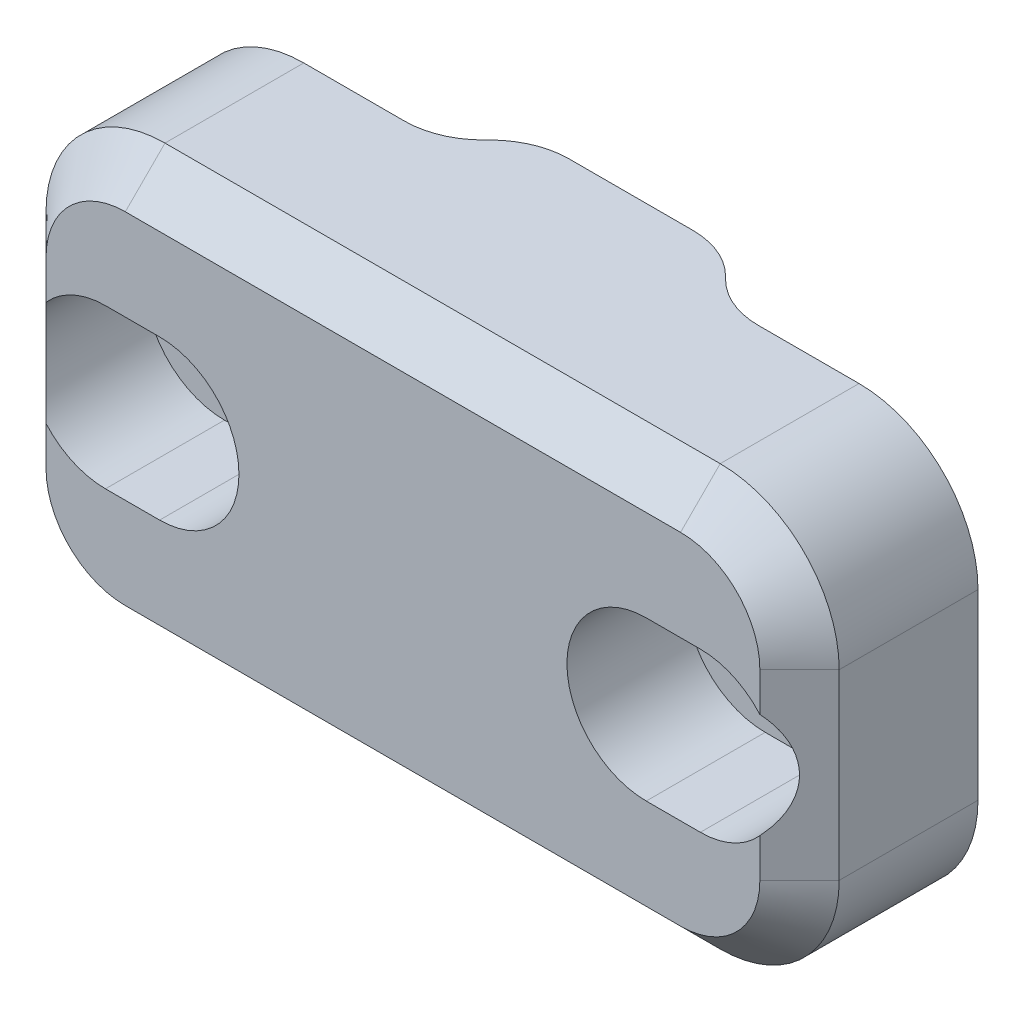
from build123d import *

# Parameters (mm, degrees)
SKETCH1_W           = 20
SKETCH1_H           = 12.6
BOSS_EXTRUDE1_DEPTH = 5
CUT_EXTRUDE1_REACH  = 19.616
SKETCH2_W           = 20
SKETCH2_H           = 0.5
CUT_EXTRUDE2_REACH  = 89.84
SKETCH3_W           = 20
SKETCH3_H           = 2
BOSS_EXTRUDE2_DEPTH = 10.6
CUT_EXTRUDE4_DEPTH  = 88.839697745
FILLET1_R           = 3
CUT_EXTRUDE5_DEPTH  = 3
CHAMFER2_SIZE       = 1
FILLET2_R           = 2


with BuildPart() as part:
    # Sketch1 → Boss-Extrude1 (new body)
    with BuildSketch(Plane.XY):
        with Locations((-1.25, 80.7)):
            Rectangle(SKETCH1_W, SKETCH1_H)
    extrude(amount=BOSS_EXTRUDE1_DEPTH)

    # Sketch2 → Cut-Extrude1 (cut, up to next)
    with BuildSketch(Plane(origin=(0, 87, 0), x_dir=(1, 0, 0), z_dir=(0, 1, 0)), mode=Mode.PRIVATE) as cut_extrude1_sk1:
        with Locations((-1.25, -0.25)):
            Rectangle(SKETCH2_W, SKETCH2_H)
    cut_extrude1_tool1 = extrude(cut_extrude1_sk1.sketch, amount=-CUT_EXTRUDE1_REACH, mode=Mode.PRIVATE) & part.part
    add(cut_extrude1_tool1.solids().sort_by_distance((-1.25, 87, 0.25))[0], mode=Mode.SUBTRACT)

    # Sketch3 → Cut-Extrude2 (cut, up to next)
    with BuildSketch(Plane.XY.offset(5), mode=Mode.PRIVATE) as cut_extrude2_sk1:
        with Locations((-1.25, 75.4)):
            Rectangle(SKETCH3_W, SKETCH3_H)
    cut_extrude2_tool1 = extrude(cut_extrude2_sk1.sketch, amount=-CUT_EXTRUDE2_REACH, mode=Mode.PRIVATE) & part.part
    add(cut_extrude2_tool1.solids().sort_by_distance((-1.25, 75.4, 5))[0], mode=Mode.SUBTRACT)

    # Sketch4 → Boss-Extrude2 (add)
    with BuildSketch(Plane(origin=(0, 87, 0), x_dir=(1, 0, 0), z_dir=(0, 1, 0))):
        Polygon((-4.884848004, -0.5), (-3.634848004, 0.75), (1.134848004, 0.75), (2.384848004, -0.5), align=None)
    extrude(amount=-BOSS_EXTRUDE2_DEPTH)

    # Sketch6 → Cut-Extrude4 (cut, symmetric)
    with BuildSketch(Plane(origin=(0, 0, 0.5), x_dir=(-1, 0, 0), z_dir=(0, 0, -1))):
        with BuildLine():
            Line((-6.317424002, 82.75), (-4.817424002, 82.75))
            ThreePointArc((-4.817424002, 82.75), (-3.767424002, 81.7), (-4.817424002, 80.65))
            Line((-4.817424002, 80.65), (-6.317424002, 80.65))
            ThreePointArc((-6.317424002, 80.65), (-7.367424002, 81.7), (-6.317424002, 82.75))
        make_face()
    cut_extrude4 = extrude(amount=CUT_EXTRUDE4_DEPTH, both=True, mode=Mode.SUBTRACT)

    # Fillet1
    fillet1_edges = [part.edges().sort_by_distance(p)[0] for p in [
        (-11.25, 87, 2.75),
        (-11.25, 76.4, 2.75),
        (8.75, 76.4, 2.75),
        (8.75, 87, 2.75),
    ]]
    fillet(fillet1_edges, radius=FILLET1_R)

    # Sketch7 → Cut-Extrude5 (cut)
    with BuildSketch(Plane.XY.offset(5)):
        with BuildLine():
            Line((6.25, 79.7), (4.884848004, 79.7))
            ThreePointArc((4.884848004, 79.7), (2.884848004, 81.7), (4.884848004, 83.7))
            Line((4.884848004, 83.7), (6.25, 83.7))
            ThreePointArc((6.25, 83.7), (8.25, 81.7), (6.25, 79.7))
        make_face()
    cut_extrude5 = extrude(amount=-CUT_EXTRUDE5_DEPTH, mode=Mode.SUBTRACT)

    # Mirror1: Cut-Extrude4, Cut-Extrude5 across plane
    add(cut_extrude4.mirror(Plane(origin=(-1.25, 0, 0), x_dir=(0, 0, 1), z_dir=(1, 0, 0))), mode=Mode.SUBTRACT)
    add(cut_extrude5.mirror(Plane(origin=(-1.25, 0, 0), x_dir=(0, 0, 1), z_dir=(1, 0, 0))), mode=Mode.SUBTRACT)

    # Chamfer2
    # the kernel refuses this chamfer: 1 mm, written as the material it takes off along each edge
    with BuildSketch(Plane(origin=(5.75, 76.4, 5), x_dir=(0, -0.02749587661058217, -0.9996219169112968), z_dir=(-1, 0, 0)), Plane(origin=(-8.25, 87, 5), x_dir=(0, 0.02749587661058217, -0.9996219169112968), z_dir=(1, 0, 0))) as chamfer2_piece_1:
        Polygon((CHAMFER2_SIZE * 0.999621916911, -CHAMFER2_SIZE * 0.0274958766106), (-CHAMFER2_SIZE * 0.0274958766106, -CHAMFER2_SIZE * 0.999621916911), (0, 0), align=None)
    extrude(amount=14, mode=Mode.SUBTRACT)
    with BuildSketch(Plane(origin=(8.75, 84, 5), x_dir=(-0.9996219169112968, 0, 0.02749587661058651), z_dir=(0, -1, 0))) as chamfer2_piece_2:
        Polygon((CHAMFER2_SIZE * 0.999621916911, CHAMFER2_SIZE * 0.0274958766106), (-CHAMFER2_SIZE * 0.0274958766106, CHAMFER2_SIZE * 0.999621916911), (0, 0), align=None)
    extrude(amount=4.6, mode=Mode.SUBTRACT)
    with BuildSketch(Plane(origin=(-11.25, 79.4, 5), x_dir=(-0.027495876610585623, 0, -0.9996219169112968), z_dir=(0, 1, 0))) as chamfer2_piece_3:
        Polygon((CHAMFER2_SIZE * 0.999621916911, -CHAMFER2_SIZE * 0.0274958766106), (-CHAMFER2_SIZE * 0.0274958766106, -CHAMFER2_SIZE * 0.999621916911), (0, 0), align=None)
    extrude(amount=4.6, mode=Mode.SUBTRACT)
    with BuildSketch(Plane(origin=(5.75, 84, 5), x_dir=(0, 1, 0), z_dir=(-1, 0, 0))) as chamfer2_piece_4:
        Polygon((3 - CHAMFER2_SIZE, 0), (3, CHAMFER2_SIZE), (3, 0), align=None)
    revolve(axis=Axis((5.75, 84, 5), (0, 0, -1)), revolution_arc=90, mode=Mode.SUBTRACT)
    with BuildSketch(Plane(origin=(-8.25, 84, 5), x_dir=(0, 1, 0), z_dir=(1, 0, 0))) as chamfer2_piece_5:
        Polygon((3, -CHAMFER2_SIZE), (3 - CHAMFER2_SIZE, 0), (3, 0), align=None)
    revolve(axis=Axis((-8.25, 84, 5), (0, 0, 1)), revolution_arc=90, mode=Mode.SUBTRACT)
    with BuildSketch(Plane(origin=(-8.25, 79.4, 5), x_dir=(0, -1, 0), z_dir=(1, 0, 0))) as chamfer2_piece_6:
        Polygon((3, CHAMFER2_SIZE), (3 - CHAMFER2_SIZE, 0), (3, 0), align=None)
    revolve(axis=Axis((-8.25, 79.4, 5), (0, 0, -1)), revolution_arc=90, mode=Mode.SUBTRACT)
    with BuildSketch(Plane(origin=(5.75, 79.4, 5), x_dir=(0, -1, 0), z_dir=(-1, 0, 0))) as chamfer2_piece_7:
        Polygon((3 - CHAMFER2_SIZE, 0), (3, -CHAMFER2_SIZE), (3, 0), align=None)
    revolve(axis=Axis((5.75, 79.4, 5), (0, 0, 1)), revolution_arc=90, mode=Mode.SUBTRACT)

    # Fillet2
    fillet2_edges = [part.edges().sort_by_distance(p)[0] for p in [
        (2.384848004, 81.7, 0.5),
        (-4.884848004, 81.7, 0.5),
        (-3.634848004, 81.7, -0.75),
        (1.134848004, 81.7, -0.75),
    ]]
    fillet(fillet2_edges, radius=FILLET2_R)


solid = part.part
